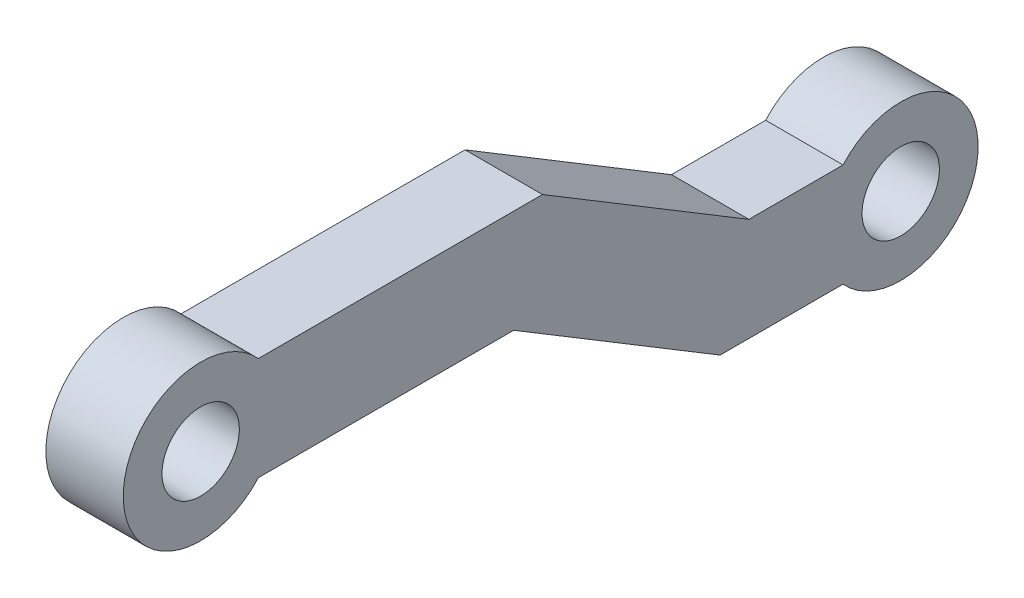
from build123d import *

# Parameters (mm, degrees)
SKETCH2_R           = 1.5
BOSS_EXTRUDE1_DEPTH = 3


with BuildPart() as part:
    # Sketch2 → Boss-Extrude1 (new body)
    with BuildSketch(Plane(origin=(0, 0, 0), x_dir=(0, 0, -1), z_dir=(1, 0, 0))):
        with BuildLine():
            Line((13.247387042, 2), (2.236067977, 2))
            ThreePointArc((2.236067977, 2), (-3, 0), (2.236067977, -2))
            Line((2.236067977, -2), (12.13290764, -2))
            Line((12.13290764, -2), (20.13290764, -6.833106971))
            Line((20.13290764, -6.833106971), (24.896839663, -6.833106971))
            ThreePointArc((24.896839663, -6.833106971), (30.13290764, -4.833106971), (24.896839663, -2.833106971))
            Line((24.896839663, -2.833106971), (21.247387042, -2.833106971))
            Line((21.247387042, -2.833106971), (13.247387042, 2))
        make_face()
        with Locations((27.13290764, -4.833106971)):
            Circle(SKETCH2_R, mode=Mode.SUBTRACT)
        Circle(SKETCH2_R, mode=Mode.SUBTRACT)
    extrude(amount=BOSS_EXTRUDE1_DEPTH)


solid = part.part
